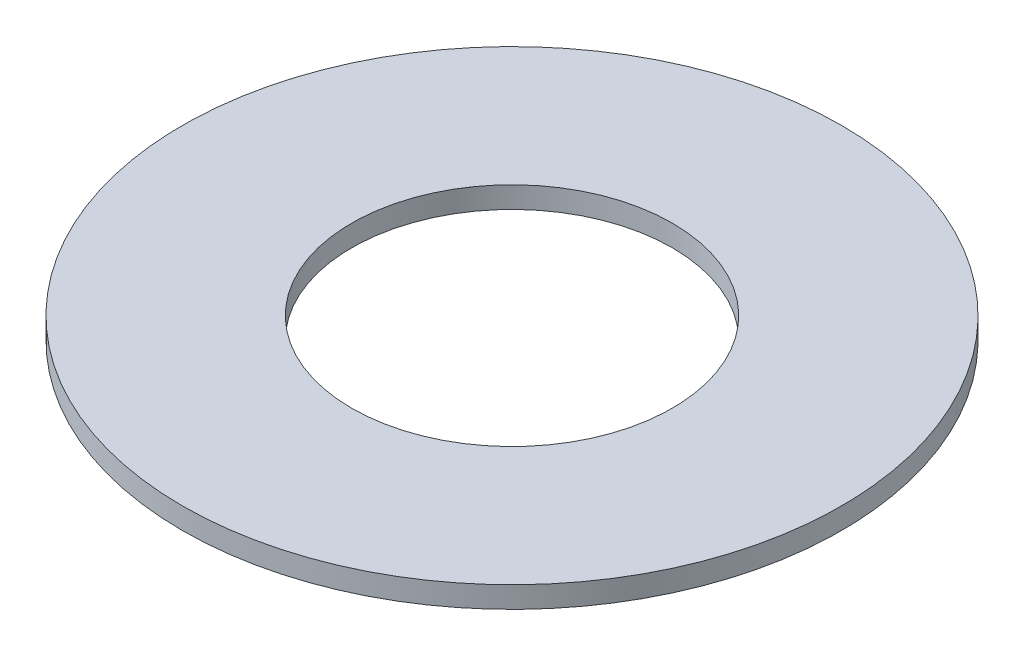
from build123d import *

# Parameters (mm, degrees)
SKETCH1_R           = 92.5
BOSS_EXTRUDE1_DEPTH = 6
SKETCH2_R           = 45
CUT_EXTRUDE1_DEPTH  = 131.952281385


with BuildPart() as part:
    # Sketch1 → Boss-Extrude1 (new body)
    with BuildSketch(Plane(origin=(0, 0, 0), x_dir=(1, 0, 0), z_dir=(0, 1, 0))):
        Circle(SKETCH1_R)
    extrude(amount=BOSS_EXTRUDE1_DEPTH)

    # Sketch2 → Cut-Extrude1 (cut, through all)
    with BuildSketch(Plane(origin=(0, 0, 0), x_dir=(1, 0, 0), z_dir=(0, 1, 0))):
        Circle(SKETCH2_R)
    extrude(amount=CUT_EXTRUDE1_DEPTH, mode=Mode.SUBTRACT)


solid = part.part
